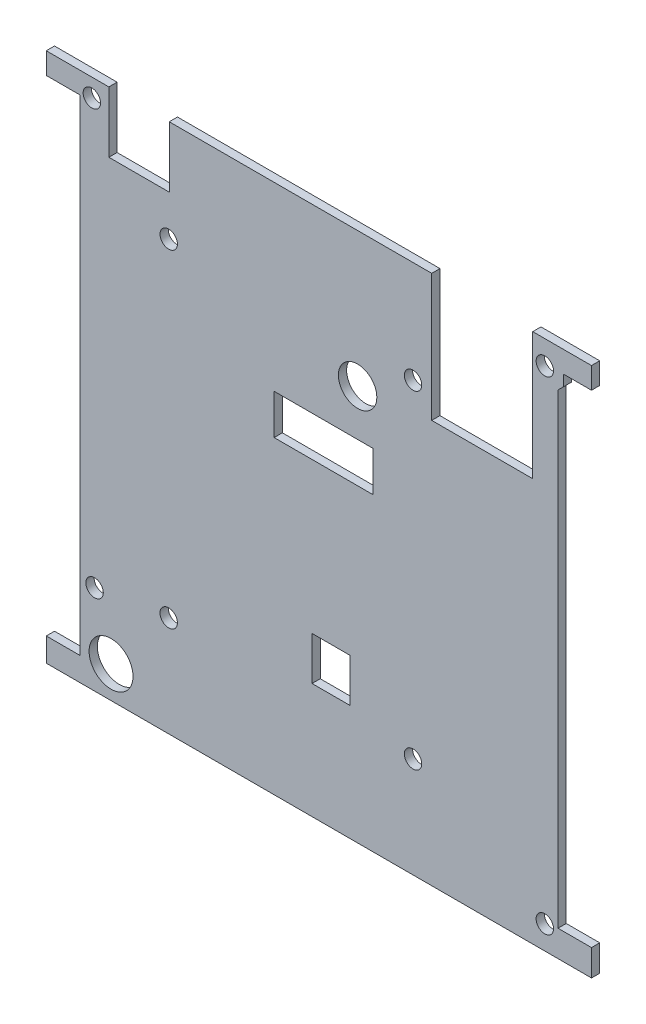
from build123d import *

# Parameters (mm, degrees)
SKETCH_1_W          = 99.3
SKETCH_1_H          = 96.6
SKETCH_1_R          = 1.585
EXTRUDE_1_DEPTH     = 1.5
SKETCH_2_R          = 3.5
SKETCH_2_R_2        = 4
SKETCH_2_W          = 18.4
SKETCH_2_H          = 23.2
SKETCH_2_W_2        = 18
SKETCH_2_H_2        = 7.3
SKETCH_2_W_3        = 6.1
SKETCH_2_H_3        = 88.4
SKETCH_2_H_4        = 87.9
SKETCH_2_W_4        = 6.9
SKETCH_2_H_5        = 7.9
SKETCH_2_W_5        = 11
SKETCH_2_H_6        = 11.1
CUT_EXTRUDE_1_DEPTH = 117.077839401
SKETCH_3_W          = 1
SKETCH_3_H          = 2
EXTRUDE_2_DEPTH     = 1.5
CHAMFER_1_SIZE      = 1


with BuildPart() as part:
    # 草图1 → 凸台-拉伸1 (new body)
    with BuildSketch(Plane.XY):
        with Locations((31.77, 34.42)):
            Rectangle(SKETCH_1_W, SKETCH_1_H)
        with Locations((48.92, 64.16)):
            Circle(SKETCH_1_R, mode=Mode.SUBTRACT)
        with Locations((4.42, 64.16)):
            Circle(SKETCH_1_R, mode=Mode.SUBTRACT)
        with Locations((4.42, 4.42)):
            Circle(SKETCH_1_R, mode=Mode.SUBTRACT)
        with Locations((48.92, 4.42)):
            Circle(SKETCH_1_R, mode=Mode.SUBTRACT)
        with Locations((-9.08, 2.42)):
            Circle(SKETCH_1_R, mode=Mode.SUBTRACT)
        with Locations((72.92, -9.58)):
            Circle(SKETCH_1_R, mode=Mode.SUBTRACT)
        with Locations((72.92, 78.42)):
            Circle(SKETCH_1_R, mode=Mode.SUBTRACT)
        with Locations((-9.58, 79.42)):
            Circle(SKETCH_1_R, mode=Mode.SUBTRACT)
    extrude(amount=EXTRUDE_1_DEPTH)

    # 草图2 → 切除-拉伸1 (cut, through all)
    with BuildSketch(Plane.XY.offset(1.5)):
        with Locations((38.82, 58.16)):
            Circle(SKETCH_2_R)
        with Locations((-6.08, -8.08)):
            Circle(SKETCH_2_R_2)
        with Locations((61.52, 71.12)):
            Rectangle(SKETCH_2_W, SKETCH_2_H)
        with Locations((32.62, 46.11)):
            Rectangle(SKETCH_2_W_2, SKETCH_2_H_2)
        with Locations((-14.83, 34.62)):
            Rectangle(SKETCH_2_W_3, SKETCH_2_H_3)
        with Locations((78.37, 34.87)):
            Rectangle(SKETCH_2_W_3, SKETCH_2_H_4)
        with Locations((33.97, 11.07)):
            Rectangle(SKETCH_2_W_4, SKETCH_2_H_5)
        with Locations((-0.98, 77.17)):
            Rectangle(SKETCH_2_W_5, SKETCH_2_H_6)
    extrude(amount=-CUT_EXTRUDE_1_DEPTH, mode=Mode.SUBTRACT)

    # 草图3 → 凸台-拉伸2 (add)
    with BuildSketch(Plane.XY.offset(1.5)):
        with Locations((75.82, 77.82)):
            Rectangle(SKETCH_3_W, SKETCH_3_H)
    extrude(amount=-EXTRUDE_2_DEPTH)

    # 倒角1
    chamfer_1_edges = [part.edges().sort_by_distance(p)[0] for p in [
        (75.32, 76.82, 0.75),
    ]]
    chamfer(chamfer_1_edges, length=CHAMFER_1_SIZE - 0.0001)  # a hair under: the kernel refuses the full size


solid = part.part
